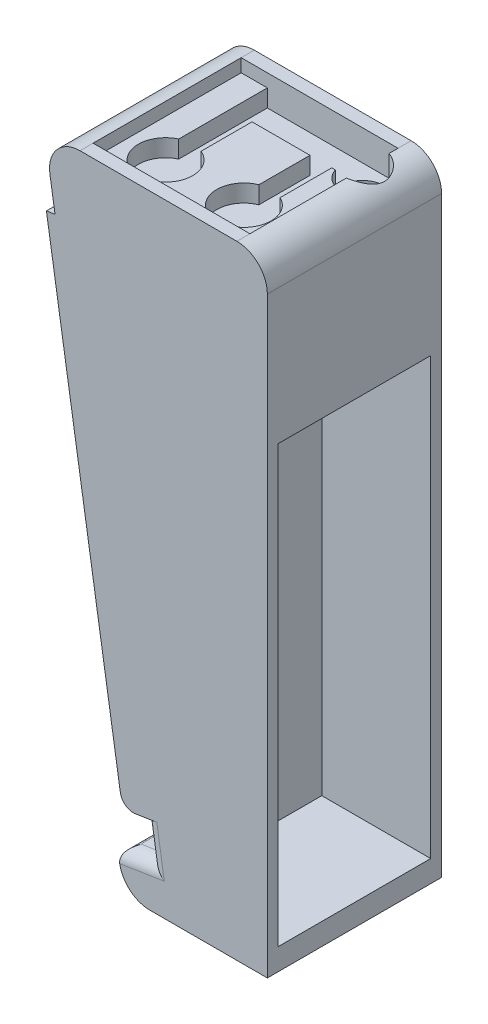
from build123d import *

# Parameters (mm, degrees)
BOSS_EXTRUDE1_DEPTH = 40
FILLET3_R           = 7
FILLET4_R           = 7
FILLET5_R           = 7
SKETCH8_W           = 40
SKETCH8_H           = 119.824449513
BOSS_EXTRUDE2_DEPTH = 2
SKETCH9_W           = 40
SKETCH9_H           = 8
CUT_EXTRUDE6_DEPTH  = 5
FILLET6_R           = 3
FILLET7_R           = 3
SKETCH10_W          = 35
SKETCH10_H          = 100
CUT_EXTRUDE7_DEPTH  = 25
SKETCH11_R          = 5
CUT_EXTRUDE8_DEPTH  = 40
SKETCH12_W          = 36.007885592
SKETCH12_H          = 34
CUT_EXTRUDE9_DEPTH  = 3
CUT_EXTRUDE10_DEPTH = 4
SKETCH15_W          = 30.007885592
SKETCH15_H          = 8.507444754
CUT_EXTRUDE12_DEPTH = 4


with BuildPart() as part:
    # Sketch1 → Boss-Extrude1 (new body)
    with BuildSketch(Plane.XY):
        Polygon((-46.572492334, -83.741881942), (-67.776571631, 50.109646847), (-16.572492334, 50.109646847), (-16.572492334, -92.866074504), (-50.572492334, -92.866074504), (-50.572492334, -83.741881942), align=None)
    extrude(amount=BOSS_EXTRUDE1_DEPTH)

    # Fillet3
    fillet3_edges = [part.edges().sort_by_distance(p)[0] for p in [
        (-50.572492334, -92.866074504, 20),
    ]]
    fillet(fillet3_edges, radius=FILLET3_R)

    # Fillet4
    fillet4_edges = [part.edges().sort_by_distance(p)[0] for p in [
        (-16.572492334, 50.109646847, 20),
    ]]
    fillet(fillet4_edges, radius=FILLET4_R)

    # Fillet5
    fillet5_edges = [part.edges().sort_by_distance(p)[0] for p in [
        (-67.776571631, 50.109646847, 20),
    ]]
    fillet(fillet5_edges, radius=FILLET5_R)

    # Sketch8 → Boss-Extrude2 (add)
    with BuildSketch(Plane(origin=(-58.373554794, -9.247242044, 0), x_dir=(0, 0, 1), z_dir=(-0.987683688709488, -0.15646383306444783, 0))):
        with Locations((20, -15.511355434)):
            Rectangle(SKETCH8_W, SKETCH8_H)
    extrude(amount=BOSS_EXTRUDE2_DEPTH)

    # Sketch9 → Cut-Extrude6 (cut)
    with BuildSketch(Plane(origin=(-60.348922171, -9.56016971, 0), x_dir=(0, 0, 1), z_dir=(-0.987683688709488, -0.1564638330644479, 0))):
        with Locations((20, -71.106750349)):
            Rectangle(SKETCH9_W, SKETCH9_H)
    extrude(amount=-CUT_EXTRUDE6_DEPTH, mode=Mode.SUBTRACT)

    # Fillet6
    # the kernel refuses this fillet: 3 mm, written as the material it takes off along each edge
    with BuildSketch(Plane(origin=(-50.572492334, -83.741881942, -8.262362342), x_dir=(1, 0, 0), z_dir=(0, 0, 1))) as fillet6_piece_1:
        with BuildLine():
            CenterArc((3.057167778, -2.798042747), FILLET6_R, 111.143346589, 78.555093673)
            Line((0.100043612, -3.303430385), (-0.195668805, -3.353969149))
            ThreePointArc((-0.195668805, -3.353969149), (-0.3, -2.124192562), (-0.3, 0))
            Line((-0.3, 0), (0, 0.3))
            ThreePointArc((0, 0.3), (0.987530106, 0.3), (1.866849455, 0.279804275))
            Line((1.866849455, 0.279804275), (1.975060211, 0))
        make_face()
    extrude(amount=56.524724683, mode=Mode.SUBTRACT)
    with BuildSketch(Plane(origin=(-49.849142787, -75.840412432, -7.5), x_dir=(-0.15646383306444783, 0.9876836887094879, 0), z_dir=(0, 0, 1))) as fillet6_piece_2:
        with BuildLine():
            CenterArc((FILLET6_R, -FILLET6_R), FILLET6_R, 90, 90)
            Line((0, -FILLET6_R), (-FILLET6_R * 0.02, -FILLET6_R))
            Line((-FILLET6_R * 0.02, -FILLET6_R), (-FILLET6_R * 0.02, FILLET6_R * 0.02))
            Line((-FILLET6_R * 0.02, FILLET6_R * 0.02), (FILLET6_R, FILLET6_R * 0.02))
            Line((FILLET6_R, FILLET6_R * 0.02), (FILLET6_R, 0))
        make_face()
    extrude(amount=55, mode=Mode.SUBTRACT)

    # Fillet7
    fillet7_edges = [part.edges().sort_by_distance(p)[0] for p in [
        (-44.284869011, -79.008828021, 0),
        (-44.284869011, -79.008828021, 40),
        (-46.128222901, -83.350722359, 0),
        (-46.128222901, -83.350722359, 40),
    ]]
    fillet(fillet7_edges, radius=FILLET7_R)

    # Sketch10 → Cut-Extrude7 (cut)
    with BuildSketch(Plane(origin=(-16.572492334, 0, 0), x_dir=(0, 0, -1), z_dir=(1, 0, 0))):
        with Locations((-20, -37.866074504)):
            Rectangle(SKETCH10_W, SKETCH10_H)
    extrude(amount=-CUT_EXTRUDE7_DEPTH, mode=Mode.SUBTRACT)

    # Sketch11 → Cut-Extrude8 (cut)
    with BuildSketch(Plane.XZ.offset(-12.133925496)):
        with Locations(Location((-24.692244137, 10, 0), (0, 0, 270))):
            Circle(SKETCH11_R)
    extrude(amount=-CUT_EXTRUDE8_DEPTH, mode=Mode.SUBTRACT)

    # Sketch12 → Cut-Extrude9 (cut)
    with BuildSketch(Plane(origin=(0, 50.109646847, 0), x_dir=(1, 0, 0), z_dir=(0, 1, 0))):
        with Locations((-41.57643513, -20)):
            Rectangle(SKETCH12_W, SKETCH12_H)
    extrude(amount=-CUT_EXTRUDE9_DEPTH, mode=Mode.SUBTRACT)

    # Sketch14 → Cut-Extrude10 (cut)
    with BuildSketch(Plane(origin=(0, 47.109646847, 0), x_dir=(1, 0, 0), z_dir=(0, 1, 0))):
        with BuildLine():
            Line((-48.580377926, -23.212665104), (-48.580377926, -9))
            Line((-48.580377926, -9), (-53.580377926, -9))
            Line((-53.580377926, -9), (-53.580377926, -23.334974507))
            ThreePointArc((-53.580377926, -23.334974507), (-50.787463759, -35.24813089), (-48.580377926, -23.212665104))
        make_face()
        with BuildLine():
            Line((-35.273431744, -9.008916267), (-30.273436234, -9.015616726))
            Line((-30.273436234, -9.015616726), (-30.292646413, -23.350578361))
            ThreePointArc((-30.292646413, -23.350578361), (-33.101522793, -35.259981286), (-35.292478017, -23.22156861))
            Line((-35.292478017, -23.22156861), (-35.273431744, -9.008916267))
        make_face()
    extrude(amount=-CUT_EXTRUDE10_DEPTH, mode=Mode.SUBTRACT)

    # Sketch15 → Cut-Extrude12 (cut)
    with BuildSketch(Plane(origin=(0, 47.109646847, 0), x_dir=(1, 0, 0), z_dir=(0, 1, 0))):
        with Locations((-38.57643513, -7.253722377)):
            Rectangle(SKETCH15_W, SKETCH15_H)
    extrude(amount=-CUT_EXTRUDE12_DEPTH, mode=Mode.SUBTRACT)


solid = part.part
